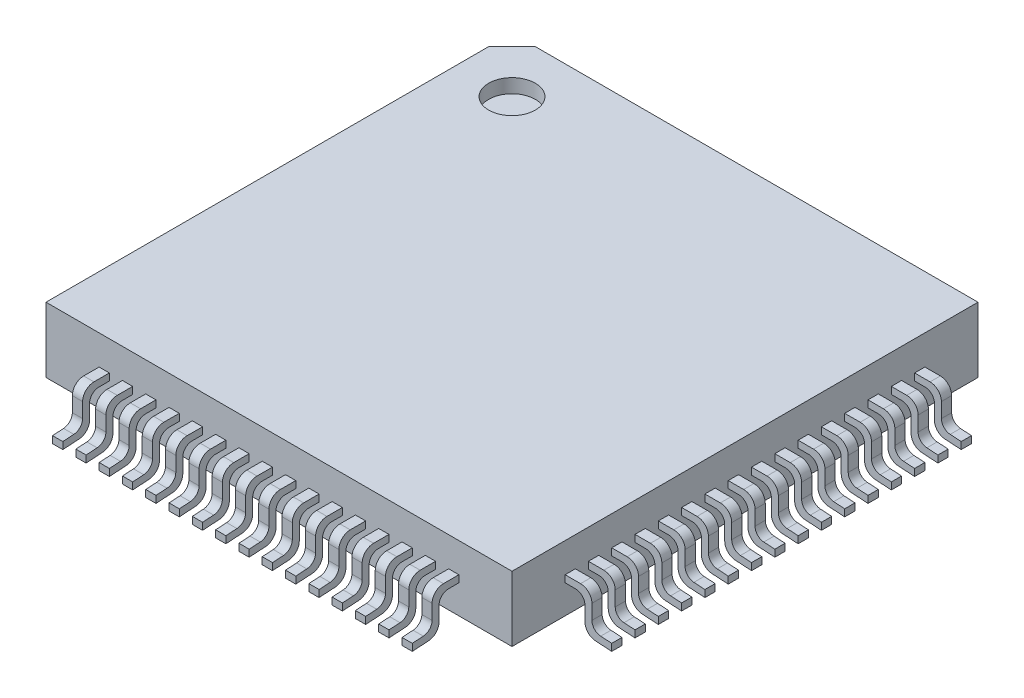
from build123d import *

# Parameters (mm, degrees)
SKETCH2_W                 = 10
SKETCH2_H                 = 10
BODY_DEPTH                = 1.4
LEAD_DEPTH                = 0.11
SD_LEADS_COUNT            = 16
SD_LEADS_PITCH            = 0.5
CIRPATTERN1_COUNT         = 4
CIRPATTERN1_COPY_1_DEPTH  = 0.11
CIRPATTERN1_COPY_2_DEPTH  = 0.11
CIRPATTERN1_COPY_3_DEPTH  = 0.11
CIRPATTERN1_COPY_4_DEPTH  = 0.11
CIRPATTERN1_COPY_5_DEPTH  = 0.11
CIRPATTERN1_COPY_6_DEPTH  = 0.11
CIRPATTERN1_COPY_7_DEPTH  = 0.11
CIRPATTERN1_COPY_8_DEPTH  = 0.11
CIRPATTERN1_COPY_9_DEPTH  = 0.11
CIRPATTERN1_COPY_10_DEPTH = 0.11
CIRPATTERN1_COPY_11_DEPTH = 0.11
CIRPATTERN1_COPY_12_DEPTH = 0.11
CIRPATTERN1_COPY_13_DEPTH = 0.11
CIRPATTERN1_COPY_14_DEPTH = 0.11
CIRPATTERN1_COPY_15_DEPTH = 0.11
CIRPATTERN1_COPY_16_DEPTH = 0.11
CIRPATTERN1_COPY_17_DEPTH = 0.11
CIRPATTERN1_COPY_18_DEPTH = 0.11
CIRPATTERN1_COPY_19_DEPTH = 0.11
CIRPATTERN1_COPY_20_DEPTH = 0.11
CIRPATTERN1_COPY_21_DEPTH = 0.11
CIRPATTERN1_COPY_22_DEPTH = 0.11
CIRPATTERN1_COPY_23_DEPTH = 0.11
CIRPATTERN1_COPY_24_DEPTH = 0.11
CIRPATTERN1_COPY_25_DEPTH = 0.11
CIRPATTERN1_COPY_26_DEPTH = 0.11
CIRPATTERN1_COPY_27_DEPTH = 0.11
CIRPATTERN1_COPY_28_DEPTH = 0.11
CIRPATTERN1_COPY_29_DEPTH = 0.11
CIRPATTERN1_COPY_30_DEPTH = 0.11
CIRPATTERN1_COPY_31_DEPTH = 0.11
CIRPATTERN1_COPY_32_DEPTH = 0.11
CIRPATTERN1_COPY_33_DEPTH = 0.11
CIRPATTERN1_COPY_34_DEPTH = 0.11
CIRPATTERN1_COPY_35_DEPTH = 0.11
CIRPATTERN1_COPY_36_DEPTH = 0.11
CIRPATTERN1_COPY_37_DEPTH = 0.11
CIRPATTERN1_COPY_38_DEPTH = 0.11
CIRPATTERN1_COPY_39_DEPTH = 0.11
CIRPATTERN1_COPY_40_DEPTH = 0.11
CIRPATTERN1_COPY_41_DEPTH = 0.11
CIRPATTERN1_COPY_42_DEPTH = 0.11
CIRPATTERN1_COPY_43_DEPTH = 0.11
CIRPATTERN1_COPY_44_DEPTH = 0.11
CIRPATTERN1_COPY_45_DEPTH = 0.11
SKETCH4_R                 = 0.5
CUT_EXTRUDE1_DEPTH        = 0.3
CHAMFER1_SIZE             = 0.5


with BuildPart() as part:
    # Sketch2 → Body (new body)
    with BuildSketch(Plane(origin=(0, 0.16, 0), x_dir=(1, 0, 0), z_dir=(0, 1, 0))):
        Rectangle(SKETCH2_W, SKETCH2_H)
    extrude(amount=BODY_DEPTH)

    # Sketch3 → Lead (add, symmetric)
    with BuildSketch(Plane.XY.offset(3.75)):
        with BuildLine():
            Line((5, 0.925), (5.331066017, 0.925))
            ThreePointArc((5.331066017, 0.925), (5.503553391, 0.853553391), (5.575, 0.681066017))
            Line((5.575, 0.681066017), (5.575, 0.36441563))
            ThreePointArc((5.575, 0.36441563), (5.629324093, 0.227380853), (5.762785301, 0.164788976))
            Line((5.762785301, 0.164788976), (6, 0.150280303))
            Line((6, 0.150280303), (6, 0))
            Line((6, 0), (5.651052254, 0.021342558))
            ThreePointArc((5.651052254, 0.021342558), (5.490394868, 0.096682424), (5.425, 0.261638181))
            Line((5.425, 0.261638181), (5.425, 0.575))
            ThreePointArc((5.425, 0.575), (5.366421356, 0.716421356), (5.225, 0.775))
            Line((5.225, 0.775), (5, 0.775))
            Line((5, 0.775), (5, 0.925))
        make_face()
    lead = extrude(amount=LEAD_DEPTH, both=True)

    # SD_Leads: Lead ×16
    with Locations(*[(0, 0, -i * SD_LEADS_PITCH) for i in range(1, SD_LEADS_COUNT)]):
        add(lead)

    # CirPattern1: Lead ×4 about axis
    cirpattern1_axis = Axis((0, 0, 0), (0, 1, 0))
    for i in range(1, CIRPATTERN1_COUNT):
        add(lead.rotate(cirpattern1_axis, i * 360 / CIRPATTERN1_COUNT))

    # CirPattern1 copy 1 sketch → CirPattern1 copy 1 (add, symmetric)
    with BuildSketch(Plane(origin=(3.25, 0, 0), x_dir=(0, 0, -1), z_dir=(1, 0, 0))):
        with BuildLine():
            Line((5, 0.925), (5.331066017, 0.925))
            ThreePointArc((5.331066017, 0.925), (5.503553391, 0.853553391), (5.575, 0.681066017))
            Line((5.575, 0.681066017), (5.575, 0.36441563))
            ThreePointArc((5.575, 0.36441563), (5.629324093, 0.227380853), (5.762785301, 0.164788976))
            Line((5.762785301, 0.164788976), (6, 0.150280303))
            Line((6, 0.150280303), (6, 0))
            Line((6, 0), (5.651052254, 0.021342558))
            ThreePointArc((5.651052254, 0.021342558), (5.490394868, 0.096682424), (5.425, 0.261638181))
            Line((5.425, 0.261638181), (5.425, 0.575))
            ThreePointArc((5.425, 0.575), (5.366421356, 0.716421356), (5.225, 0.775))
            Line((5.225, 0.775), (5, 0.775))
            Line((5, 0.775), (5, 0.925))
        make_face()
    extrude(amount=CIRPATTERN1_COPY_1_DEPTH, both=True)

    # CirPattern1 copy 2 sketch → CirPattern1 copy 2 (add, symmetric)
    with BuildSketch(Plane(origin=(0, 0, -3.25), x_dir=(-1, 0, 0), z_dir=(0, 0, -1))):
        with BuildLine():
            Line((5, 0.925), (5.331066017, 0.925))
            ThreePointArc((5.331066017, 0.925), (5.503553391, 0.853553391), (5.575, 0.681066017))
            Line((5.575, 0.681066017), (5.575, 0.36441563))
            ThreePointArc((5.575, 0.36441563), (5.629324093, 0.227380853), (5.762785301, 0.164788976))
            Line((5.762785301, 0.164788976), (6, 0.150280303))
            Line((6, 0.150280303), (6, 0))
            Line((6, 0), (5.651052254, 0.021342558))
            ThreePointArc((5.651052254, 0.021342558), (5.490394868, 0.096682424), (5.425, 0.261638181))
            Line((5.425, 0.261638181), (5.425, 0.575))
            ThreePointArc((5.425, 0.575), (5.366421356, 0.716421356), (5.225, 0.775))
            Line((5.225, 0.775), (5, 0.775))
            Line((5, 0.775), (5, 0.925))
        make_face()
    extrude(amount=CIRPATTERN1_COPY_2_DEPTH, both=True)

    # CirPattern1 copy 3 sketch → CirPattern1 copy 3 (add, symmetric)
    with BuildSketch(Plane.ZY.offset(3.25)):
        with BuildLine():
            Line((5, 0.925), (5.331066017, 0.925))
            ThreePointArc((5.331066017, 0.925), (5.503553391, 0.853553391), (5.575, 0.681066017))
            Line((5.575, 0.681066017), (5.575, 0.36441563))
            ThreePointArc((5.575, 0.36441563), (5.629324093, 0.227380853), (5.762785301, 0.164788976))
            Line((5.762785301, 0.164788976), (6, 0.150280303))
            Line((6, 0.150280303), (6, 0))
            Line((6, 0), (5.651052254, 0.021342558))
            ThreePointArc((5.651052254, 0.021342558), (5.490394868, 0.096682424), (5.425, 0.261638181))
            Line((5.425, 0.261638181), (5.425, 0.575))
            ThreePointArc((5.425, 0.575), (5.366421356, 0.716421356), (5.225, 0.775))
            Line((5.225, 0.775), (5, 0.775))
            Line((5, 0.775), (5, 0.925))
        make_face()
    extrude(amount=CIRPATTERN1_COPY_3_DEPTH, both=True)

    # CirPattern1 copy 4 sketch → CirPattern1 copy 4 (add, symmetric)
    with BuildSketch(Plane(origin=(2.75, 0, 0), x_dir=(0, 0, -1), z_dir=(1, 0, 0))):
        with BuildLine():
            Line((5, 0.925), (5.331066017, 0.925))
            ThreePointArc((5.331066017, 0.925), (5.503553391, 0.853553391), (5.575, 0.681066017))
            Line((5.575, 0.681066017), (5.575, 0.36441563))
            ThreePointArc((5.575, 0.36441563), (5.629324093, 0.227380853), (5.762785301, 0.164788976))
            Line((5.762785301, 0.164788976), (6, 0.150280303))
            Line((6, 0.150280303), (6, 0))
            Line((6, 0), (5.651052254, 0.021342558))
            ThreePointArc((5.651052254, 0.021342558), (5.490394868, 0.096682424), (5.425, 0.261638181))
            Line((5.425, 0.261638181), (5.425, 0.575))
            ThreePointArc((5.425, 0.575), (5.366421356, 0.716421356), (5.225, 0.775))
            Line((5.225, 0.775), (5, 0.775))
            Line((5, 0.775), (5, 0.925))
        make_face()
    extrude(amount=CIRPATTERN1_COPY_4_DEPTH, both=True)

    # CirPattern1 copy 5 sketch → CirPattern1 copy 5 (add, symmetric)
    with BuildSketch(Plane(origin=(0, 0, -2.75), x_dir=(-1, 0, 0), z_dir=(0, 0, -1))):
        with BuildLine():
            Line((5, 0.925), (5.331066017, 0.925))
            ThreePointArc((5.331066017, 0.925), (5.503553391, 0.853553391), (5.575, 0.681066017))
            Line((5.575, 0.681066017), (5.575, 0.36441563))
            ThreePointArc((5.575, 0.36441563), (5.629324093, 0.227380853), (5.762785301, 0.164788976))
            Line((5.762785301, 0.164788976), (6, 0.150280303))
            Line((6, 0.150280303), (6, 0))
            Line((6, 0), (5.651052254, 0.021342558))
            ThreePointArc((5.651052254, 0.021342558), (5.490394868, 0.096682424), (5.425, 0.261638181))
            Line((5.425, 0.261638181), (5.425, 0.575))
            ThreePointArc((5.425, 0.575), (5.366421356, 0.716421356), (5.225, 0.775))
            Line((5.225, 0.775), (5, 0.775))
            Line((5, 0.775), (5, 0.925))
        make_face()
    extrude(amount=CIRPATTERN1_COPY_5_DEPTH, both=True)

    # CirPattern1 copy 6 sketch → CirPattern1 copy 6 (add, symmetric)
    with BuildSketch(Plane.ZY.offset(2.75)):
        with BuildLine():
            Line((5, 0.925), (5.331066017, 0.925))
            ThreePointArc((5.331066017, 0.925), (5.503553391, 0.853553391), (5.575, 0.681066017))
            Line((5.575, 0.681066017), (5.575, 0.36441563))
            ThreePointArc((5.575, 0.36441563), (5.629324093, 0.227380853), (5.762785301, 0.164788976))
            Line((5.762785301, 0.164788976), (6, 0.150280303))
            Line((6, 0.150280303), (6, 0))
            Line((6, 0), (5.651052254, 0.021342558))
            ThreePointArc((5.651052254, 0.021342558), (5.490394868, 0.096682424), (5.425, 0.261638181))
            Line((5.425, 0.261638181), (5.425, 0.575))
            ThreePointArc((5.425, 0.575), (5.366421356, 0.716421356), (5.225, 0.775))
            Line((5.225, 0.775), (5, 0.775))
            Line((5, 0.775), (5, 0.925))
        make_face()
    extrude(amount=CIRPATTERN1_COPY_6_DEPTH, both=True)

    # CirPattern1 copy 7 sketch → CirPattern1 copy 7 (add, symmetric)
    with BuildSketch(Plane(origin=(2.25, 0, 0), x_dir=(0, 0, -1), z_dir=(1, 0, 0))):
        with BuildLine():
            Line((5, 0.925), (5.331066017, 0.925))
            ThreePointArc((5.331066017, 0.925), (5.503553391, 0.853553391), (5.575, 0.681066017))
            Line((5.575, 0.681066017), (5.575, 0.36441563))
            ThreePointArc((5.575, 0.36441563), (5.629324093, 0.227380853), (5.762785301, 0.164788976))
            Line((5.762785301, 0.164788976), (6, 0.150280303))
            Line((6, 0.150280303), (6, 0))
            Line((6, 0), (5.651052254, 0.021342558))
            ThreePointArc((5.651052254, 0.021342558), (5.490394868, 0.096682424), (5.425, 0.261638181))
            Line((5.425, 0.261638181), (5.425, 0.575))
            ThreePointArc((5.425, 0.575), (5.366421356, 0.716421356), (5.225, 0.775))
            Line((5.225, 0.775), (5, 0.775))
            Line((5, 0.775), (5, 0.925))
        make_face()
    extrude(amount=CIRPATTERN1_COPY_7_DEPTH, both=True)

    # CirPattern1 copy 8 sketch → CirPattern1 copy 8 (add, symmetric)
    with BuildSketch(Plane(origin=(0, 0, -2.25), x_dir=(-1, 0, 0), z_dir=(0, 0, -1))):
        with BuildLine():
            Line((5, 0.925), (5.331066017, 0.925))
            ThreePointArc((5.331066017, 0.925), (5.503553391, 0.853553391), (5.575, 0.681066017))
            Line((5.575, 0.681066017), (5.575, 0.36441563))
            ThreePointArc((5.575, 0.36441563), (5.629324093, 0.227380853), (5.762785301, 0.164788976))
            Line((5.762785301, 0.164788976), (6, 0.150280303))
            Line((6, 0.150280303), (6, 0))
            Line((6, 0), (5.651052254, 0.021342558))
            ThreePointArc((5.651052254, 0.021342558), (5.490394868, 0.096682424), (5.425, 0.261638181))
            Line((5.425, 0.261638181), (5.425, 0.575))
            ThreePointArc((5.425, 0.575), (5.366421356, 0.716421356), (5.225, 0.775))
            Line((5.225, 0.775), (5, 0.775))
            Line((5, 0.775), (5, 0.925))
        make_face()
    extrude(amount=CIRPATTERN1_COPY_8_DEPTH, both=True)

    # CirPattern1 copy 9 sketch → CirPattern1 copy 9 (add, symmetric)
    with BuildSketch(Plane.ZY.offset(2.25)):
        with BuildLine():
            Line((5, 0.925), (5.331066017, 0.925))
            ThreePointArc((5.331066017, 0.925), (5.503553391, 0.853553391), (5.575, 0.681066017))
            Line((5.575, 0.681066017), (5.575, 0.36441563))
            ThreePointArc((5.575, 0.36441563), (5.629324093, 0.227380853), (5.762785301, 0.164788976))
            Line((5.762785301, 0.164788976), (6, 0.150280303))
            Line((6, 0.150280303), (6, 0))
            Line((6, 0), (5.651052254, 0.021342558))
            ThreePointArc((5.651052254, 0.021342558), (5.490394868, 0.096682424), (5.425, 0.261638181))
            Line((5.425, 0.261638181), (5.425, 0.575))
            ThreePointArc((5.425, 0.575), (5.366421356, 0.716421356), (5.225, 0.775))
            Line((5.225, 0.775), (5, 0.775))
            Line((5, 0.775), (5, 0.925))
        make_face()
    extrude(amount=CIRPATTERN1_COPY_9_DEPTH, both=True)

    # CirPattern1 copy 10 sketch → CirPattern1 copy 10 (add, symmetric)
    with BuildSketch(Plane(origin=(1.75, 0, 0), x_dir=(0, 0, -1), z_dir=(1, 0, 0))):
        with BuildLine():
            Line((5, 0.925), (5.331066017, 0.925))
            ThreePointArc((5.331066017, 0.925), (5.503553391, 0.853553391), (5.575, 0.681066017))
            Line((5.575, 0.681066017), (5.575, 0.36441563))
            ThreePointArc((5.575, 0.36441563), (5.629324093, 0.227380853), (5.762785301, 0.164788976))
            Line((5.762785301, 0.164788976), (6, 0.150280303))
            Line((6, 0.150280303), (6, 0))
            Line((6, 0), (5.651052254, 0.021342558))
            ThreePointArc((5.651052254, 0.021342558), (5.490394868, 0.096682424), (5.425, 0.261638181))
            Line((5.425, 0.261638181), (5.425, 0.575))
            ThreePointArc((5.425, 0.575), (5.366421356, 0.716421356), (5.225, 0.775))
            Line((5.225, 0.775), (5, 0.775))
            Line((5, 0.775), (5, 0.925))
        make_face()
    extrude(amount=CIRPATTERN1_COPY_10_DEPTH, both=True)

    # CirPattern1 copy 11 sketch → CirPattern1 copy 11 (add, symmetric)
    with BuildSketch(Plane(origin=(0, 0, -1.75), x_dir=(-1, 0, 0), z_dir=(0, 0, -1))):
        with BuildLine():
            Line((5, 0.925), (5.331066017, 0.925))
            ThreePointArc((5.331066017, 0.925), (5.503553391, 0.853553391), (5.575, 0.681066017))
            Line((5.575, 0.681066017), (5.575, 0.36441563))
            ThreePointArc((5.575, 0.36441563), (5.629324093, 0.227380853), (5.762785301, 0.164788976))
            Line((5.762785301, 0.164788976), (6, 0.150280303))
            Line((6, 0.150280303), (6, 0))
            Line((6, 0), (5.651052254, 0.021342558))
            ThreePointArc((5.651052254, 0.021342558), (5.490394868, 0.096682424), (5.425, 0.261638181))
            Line((5.425, 0.261638181), (5.425, 0.575))
            ThreePointArc((5.425, 0.575), (5.366421356, 0.716421356), (5.225, 0.775))
            Line((5.225, 0.775), (5, 0.775))
            Line((5, 0.775), (5, 0.925))
        make_face()
    extrude(amount=CIRPATTERN1_COPY_11_DEPTH, both=True)

    # CirPattern1 copy 12 sketch → CirPattern1 copy 12 (add, symmetric)
    with BuildSketch(Plane.ZY.offset(1.75)):
        with BuildLine():
            Line((5, 0.925), (5.331066017, 0.925))
            ThreePointArc((5.331066017, 0.925), (5.503553391, 0.853553391), (5.575, 0.681066017))
            Line((5.575, 0.681066017), (5.575, 0.36441563))
            ThreePointArc((5.575, 0.36441563), (5.629324093, 0.227380853), (5.762785301, 0.164788976))
            Line((5.762785301, 0.164788976), (6, 0.150280303))
            Line((6, 0.150280303), (6, 0))
            Line((6, 0), (5.651052254, 0.021342558))
            ThreePointArc((5.651052254, 0.021342558), (5.490394868, 0.096682424), (5.425, 0.261638181))
            Line((5.425, 0.261638181), (5.425, 0.575))
            ThreePointArc((5.425, 0.575), (5.366421356, 0.716421356), (5.225, 0.775))
            Line((5.225, 0.775), (5, 0.775))
            Line((5, 0.775), (5, 0.925))
        make_face()
    extrude(amount=CIRPATTERN1_COPY_12_DEPTH, both=True)

    # CirPattern1 copy 13 sketch → CirPattern1 copy 13 (add, symmetric)
    with BuildSketch(Plane(origin=(1.25, 0, 0), x_dir=(0, 0, -1), z_dir=(1, 0, 0))):
        with BuildLine():
            Line((5, 0.925), (5.331066017, 0.925))
            ThreePointArc((5.331066017, 0.925), (5.503553391, 0.853553391), (5.575, 0.681066017))
            Line((5.575, 0.681066017), (5.575, 0.36441563))
            ThreePointArc((5.575, 0.36441563), (5.629324093, 0.227380853), (5.762785301, 0.164788976))
            Line((5.762785301, 0.164788976), (6, 0.150280303))
            Line((6, 0.150280303), (6, 0))
            Line((6, 0), (5.651052254, 0.021342558))
            ThreePointArc((5.651052254, 0.021342558), (5.490394868, 0.096682424), (5.425, 0.261638181))
            Line((5.425, 0.261638181), (5.425, 0.575))
            ThreePointArc((5.425, 0.575), (5.366421356, 0.716421356), (5.225, 0.775))
            Line((5.225, 0.775), (5, 0.775))
            Line((5, 0.775), (5, 0.925))
        make_face()
    extrude(amount=CIRPATTERN1_COPY_13_DEPTH, both=True)

    # CirPattern1 copy 14 sketch → CirPattern1 copy 14 (add, symmetric)
    with BuildSketch(Plane(origin=(0, 0, -1.25), x_dir=(-1, 0, 0), z_dir=(0, 0, -1))):
        with BuildLine():
            Line((5, 0.925), (5.331066017, 0.925))
            ThreePointArc((5.331066017, 0.925), (5.503553391, 0.853553391), (5.575, 0.681066017))
            Line((5.575, 0.681066017), (5.575, 0.36441563))
            ThreePointArc((5.575, 0.36441563), (5.629324093, 0.227380853), (5.762785301, 0.164788976))
            Line((5.762785301, 0.164788976), (6, 0.150280303))
            Line((6, 0.150280303), (6, 0))
            Line((6, 0), (5.651052254, 0.021342558))
            ThreePointArc((5.651052254, 0.021342558), (5.490394868, 0.096682424), (5.425, 0.261638181))
            Line((5.425, 0.261638181), (5.425, 0.575))
            ThreePointArc((5.425, 0.575), (5.366421356, 0.716421356), (5.225, 0.775))
            Line((5.225, 0.775), (5, 0.775))
            Line((5, 0.775), (5, 0.925))
        make_face()
    extrude(amount=CIRPATTERN1_COPY_14_DEPTH, both=True)

    # CirPattern1 copy 15 sketch → CirPattern1 copy 15 (add, symmetric)
    with BuildSketch(Plane.ZY.offset(1.25)):
        with BuildLine():
            Line((5, 0.925), (5.331066017, 0.925))
            ThreePointArc((5.331066017, 0.925), (5.503553391, 0.853553391), (5.575, 0.681066017))
            Line((5.575, 0.681066017), (5.575, 0.36441563))
            ThreePointArc((5.575, 0.36441563), (5.629324093, 0.227380853), (5.762785301, 0.164788976))
            Line((5.762785301, 0.164788976), (6, 0.150280303))
            Line((6, 0.150280303), (6, 0))
            Line((6, 0), (5.651052254, 0.021342558))
            ThreePointArc((5.651052254, 0.021342558), (5.490394868, 0.096682424), (5.425, 0.261638181))
            Line((5.425, 0.261638181), (5.425, 0.575))
            ThreePointArc((5.425, 0.575), (5.366421356, 0.716421356), (5.225, 0.775))
            Line((5.225, 0.775), (5, 0.775))
            Line((5, 0.775), (5, 0.925))
        make_face()
    extrude(amount=CIRPATTERN1_COPY_15_DEPTH, both=True)

    # CirPattern1 copy 16 sketch → CirPattern1 copy 16 (add, symmetric)
    with BuildSketch(Plane(origin=(0.75, 0, 0), x_dir=(0, 0, -1), z_dir=(1, 0, 0))):
        with BuildLine():
            Line((5, 0.925), (5.331066017, 0.925))
            ThreePointArc((5.331066017, 0.925), (5.503553391, 0.853553391), (5.575, 0.681066017))
            Line((5.575, 0.681066017), (5.575, 0.36441563))
            ThreePointArc((5.575, 0.36441563), (5.629324093, 0.227380853), (5.762785301, 0.164788976))
            Line((5.762785301, 0.164788976), (6, 0.150280303))
            Line((6, 0.150280303), (6, 0))
            Line((6, 0), (5.651052254, 0.021342558))
            ThreePointArc((5.651052254, 0.021342558), (5.490394868, 0.096682424), (5.425, 0.261638181))
            Line((5.425, 0.261638181), (5.425, 0.575))
            ThreePointArc((5.425, 0.575), (5.366421356, 0.716421356), (5.225, 0.775))
            Line((5.225, 0.775), (5, 0.775))
            Line((5, 0.775), (5, 0.925))
        make_face()
    extrude(amount=CIRPATTERN1_COPY_16_DEPTH, both=True)

    # CirPattern1 copy 17 sketch → CirPattern1 copy 17 (add, symmetric)
    with BuildSketch(Plane(origin=(0, 0, -0.75), x_dir=(-1, 0, 0), z_dir=(0, 0, -1))):
        with BuildLine():
            Line((5, 0.925), (5.331066017, 0.925))
            ThreePointArc((5.331066017, 0.925), (5.503553391, 0.853553391), (5.575, 0.681066017))
            Line((5.575, 0.681066017), (5.575, 0.36441563))
            ThreePointArc((5.575, 0.36441563), (5.629324093, 0.227380853), (5.762785301, 0.164788976))
            Line((5.762785301, 0.164788976), (6, 0.150280303))
            Line((6, 0.150280303), (6, 0))
            Line((6, 0), (5.651052254, 0.021342558))
            ThreePointArc((5.651052254, 0.021342558), (5.490394868, 0.096682424), (5.425, 0.261638181))
            Line((5.425, 0.261638181), (5.425, 0.575))
            ThreePointArc((5.425, 0.575), (5.366421356, 0.716421356), (5.225, 0.775))
            Line((5.225, 0.775), (5, 0.775))
            Line((5, 0.775), (5, 0.925))
        make_face()
    extrude(amount=CIRPATTERN1_COPY_17_DEPTH, both=True)

    # CirPattern1 copy 18 sketch → CirPattern1 copy 18 (add, symmetric)
    with BuildSketch(Plane.ZY.offset(0.75)):
        with BuildLine():
            Line((5, 0.925), (5.331066017, 0.925))
            ThreePointArc((5.331066017, 0.925), (5.503553391, 0.853553391), (5.575, 0.681066017))
            Line((5.575, 0.681066017), (5.575, 0.36441563))
            ThreePointArc((5.575, 0.36441563), (5.629324093, 0.227380853), (5.762785301, 0.164788976))
            Line((5.762785301, 0.164788976), (6, 0.150280303))
            Line((6, 0.150280303), (6, 0))
            Line((6, 0), (5.651052254, 0.021342558))
            ThreePointArc((5.651052254, 0.021342558), (5.490394868, 0.096682424), (5.425, 0.261638181))
            Line((5.425, 0.261638181), (5.425, 0.575))
            ThreePointArc((5.425, 0.575), (5.366421356, 0.716421356), (5.225, 0.775))
            Line((5.225, 0.775), (5, 0.775))
            Line((5, 0.775), (5, 0.925))
        make_face()
    extrude(amount=CIRPATTERN1_COPY_18_DEPTH, both=True)

    # CirPattern1 copy 19 sketch → CirPattern1 copy 19 (add, symmetric)
    with BuildSketch(Plane(origin=(0.25, 0, 0), x_dir=(0, 0, -1), z_dir=(1, 0, 0))):
        with BuildLine():
            Line((5, 0.925), (5.331066017, 0.925))
            ThreePointArc((5.331066017, 0.925), (5.503553391, 0.853553391), (5.575, 0.681066017))
            Line((5.575, 0.681066017), (5.575, 0.36441563))
            ThreePointArc((5.575, 0.36441563), (5.629324093, 0.227380853), (5.762785301, 0.164788976))
            Line((5.762785301, 0.164788976), (6, 0.150280303))
            Line((6, 0.150280303), (6, 0))
            Line((6, 0), (5.651052254, 0.021342558))
            ThreePointArc((5.651052254, 0.021342558), (5.490394868, 0.096682424), (5.425, 0.261638181))
            Line((5.425, 0.261638181), (5.425, 0.575))
            ThreePointArc((5.425, 0.575), (5.366421356, 0.716421356), (5.225, 0.775))
            Line((5.225, 0.775), (5, 0.775))
            Line((5, 0.775), (5, 0.925))
        make_face()
    extrude(amount=CIRPATTERN1_COPY_19_DEPTH, both=True)

    # CirPattern1 copy 20 sketch → CirPattern1 copy 20 (add, symmetric)
    with BuildSketch(Plane(origin=(0, 0, -0.25), x_dir=(-1, 0, 0), z_dir=(0, 0, -1))):
        with BuildLine():
            Line((5, 0.925), (5.331066017, 0.925))
            ThreePointArc((5.331066017, 0.925), (5.503553391, 0.853553391), (5.575, 0.681066017))
            Line((5.575, 0.681066017), (5.575, 0.36441563))
            ThreePointArc((5.575, 0.36441563), (5.629324093, 0.227380853), (5.762785301, 0.164788976))
            Line((5.762785301, 0.164788976), (6, 0.150280303))
            Line((6, 0.150280303), (6, 0))
            Line((6, 0), (5.651052254, 0.021342558))
            ThreePointArc((5.651052254, 0.021342558), (5.490394868, 0.096682424), (5.425, 0.261638181))
            Line((5.425, 0.261638181), (5.425, 0.575))
            ThreePointArc((5.425, 0.575), (5.366421356, 0.716421356), (5.225, 0.775))
            Line((5.225, 0.775), (5, 0.775))
            Line((5, 0.775), (5, 0.925))
        make_face()
    extrude(amount=CIRPATTERN1_COPY_20_DEPTH, both=True)

    # CirPattern1 copy 21 sketch → CirPattern1 copy 21 (add, symmetric)
    with BuildSketch(Plane.ZY.offset(0.25)):
        with BuildLine():
            Line((5, 0.925), (5.331066017, 0.925))
            ThreePointArc((5.331066017, 0.925), (5.503553391, 0.853553391), (5.575, 0.681066017))
            Line((5.575, 0.681066017), (5.575, 0.36441563))
            ThreePointArc((5.575, 0.36441563), (5.629324093, 0.227380853), (5.762785301, 0.164788976))
            Line((5.762785301, 0.164788976), (6, 0.150280303))
            Line((6, 0.150280303), (6, 0))
            Line((6, 0), (5.651052254, 0.021342558))
            ThreePointArc((5.651052254, 0.021342558), (5.490394868, 0.096682424), (5.425, 0.261638181))
            Line((5.425, 0.261638181), (5.425, 0.575))
            ThreePointArc((5.425, 0.575), (5.366421356, 0.716421356), (5.225, 0.775))
            Line((5.225, 0.775), (5, 0.775))
            Line((5, 0.775), (5, 0.925))
        make_face()
    extrude(amount=CIRPATTERN1_COPY_21_DEPTH, both=True)

    # CirPattern1 copy 22 sketch → CirPattern1 copy 22 (add, symmetric)
    with BuildSketch(Plane(origin=(-0.25, 0, 0), x_dir=(0, 0, -1), z_dir=(1, 0, 0))):
        with BuildLine():
            Line((5, 0.925), (5.331066017, 0.925))
            ThreePointArc((5.331066017, 0.925), (5.503553391, 0.853553391), (5.575, 0.681066017))
            Line((5.575, 0.681066017), (5.575, 0.36441563))
            ThreePointArc((5.575, 0.36441563), (5.629324093, 0.227380853), (5.762785301, 0.164788976))
            Line((5.762785301, 0.164788976), (6, 0.150280303))
            Line((6, 0.150280303), (6, 0))
            Line((6, 0), (5.651052254, 0.021342558))
            ThreePointArc((5.651052254, 0.021342558), (5.490394868, 0.096682424), (5.425, 0.261638181))
            Line((5.425, 0.261638181), (5.425, 0.575))
            ThreePointArc((5.425, 0.575), (5.366421356, 0.716421356), (5.225, 0.775))
            Line((5.225, 0.775), (5, 0.775))
            Line((5, 0.775), (5, 0.925))
        make_face()
    extrude(amount=CIRPATTERN1_COPY_22_DEPTH, both=True)

    # CirPattern1 copy 23 sketch → CirPattern1 copy 23 (add, symmetric)
    with BuildSketch(Plane(origin=(0, 0, 0.25), x_dir=(-1, 0, 0), z_dir=(0, 0, -1))):
        with BuildLine():
            Line((5, 0.925), (5.331066017, 0.925))
            ThreePointArc((5.331066017, 0.925), (5.503553391, 0.853553391), (5.575, 0.681066017))
            Line((5.575, 0.681066017), (5.575, 0.36441563))
            ThreePointArc((5.575, 0.36441563), (5.629324093, 0.227380853), (5.762785301, 0.164788976))
            Line((5.762785301, 0.164788976), (6, 0.150280303))
            Line((6, 0.150280303), (6, 0))
            Line((6, 0), (5.651052254, 0.021342558))
            ThreePointArc((5.651052254, 0.021342558), (5.490394868, 0.096682424), (5.425, 0.261638181))
            Line((5.425, 0.261638181), (5.425, 0.575))
            ThreePointArc((5.425, 0.575), (5.366421356, 0.716421356), (5.225, 0.775))
            Line((5.225, 0.775), (5, 0.775))
            Line((5, 0.775), (5, 0.925))
        make_face()
    extrude(amount=CIRPATTERN1_COPY_23_DEPTH, both=True)

    # CirPattern1 copy 24 sketch → CirPattern1 copy 24 (add, symmetric)
    with BuildSketch(Plane.ZY.offset(-0.25)):
        with BuildLine():
            Line((5, 0.925), (5.331066017, 0.925))
            ThreePointArc((5.331066017, 0.925), (5.503553391, 0.853553391), (5.575, 0.681066017))
            Line((5.575, 0.681066017), (5.575, 0.36441563))
            ThreePointArc((5.575, 0.36441563), (5.629324093, 0.227380853), (5.762785301, 0.164788976))
            Line((5.762785301, 0.164788976), (6, 0.150280303))
            Line((6, 0.150280303), (6, 0))
            Line((6, 0), (5.651052254, 0.021342558))
            ThreePointArc((5.651052254, 0.021342558), (5.490394868, 0.096682424), (5.425, 0.261638181))
            Line((5.425, 0.261638181), (5.425, 0.575))
            ThreePointArc((5.425, 0.575), (5.366421356, 0.716421356), (5.225, 0.775))
            Line((5.225, 0.775), (5, 0.775))
            Line((5, 0.775), (5, 0.925))
        make_face()
    extrude(amount=CIRPATTERN1_COPY_24_DEPTH, both=True)

    # CirPattern1 copy 25 sketch → CirPattern1 copy 25 (add, symmetric)
    with BuildSketch(Plane(origin=(-0.75, 0, 0), x_dir=(0, 0, -1), z_dir=(1, 0, 0))):
        with BuildLine():
            Line((5, 0.925), (5.331066017, 0.925))
            ThreePointArc((5.331066017, 0.925), (5.503553391, 0.853553391), (5.575, 0.681066017))
            Line((5.575, 0.681066017), (5.575, 0.36441563))
            ThreePointArc((5.575, 0.36441563), (5.629324093, 0.227380853), (5.762785301, 0.164788976))
            Line((5.762785301, 0.164788976), (6, 0.150280303))
            Line((6, 0.150280303), (6, 0))
            Line((6, 0), (5.651052254, 0.021342558))
            ThreePointArc((5.651052254, 0.021342558), (5.490394868, 0.096682424), (5.425, 0.261638181))
            Line((5.425, 0.261638181), (5.425, 0.575))
            ThreePointArc((5.425, 0.575), (5.366421356, 0.716421356), (5.225, 0.775))
            Line((5.225, 0.775), (5, 0.775))
            Line((5, 0.775), (5, 0.925))
        make_face()
    extrude(amount=CIRPATTERN1_COPY_25_DEPTH, both=True)

    # CirPattern1 copy 26 sketch → CirPattern1 copy 26 (add, symmetric)
    with BuildSketch(Plane(origin=(0, 0, 0.75), x_dir=(-1, 0, 0), z_dir=(0, 0, -1))):
        with BuildLine():
            Line((5, 0.925), (5.331066017, 0.925))
            ThreePointArc((5.331066017, 0.925), (5.503553391, 0.853553391), (5.575, 0.681066017))
            Line((5.575, 0.681066017), (5.575, 0.36441563))
            ThreePointArc((5.575, 0.36441563), (5.629324093, 0.227380853), (5.762785301, 0.164788976))
            Line((5.762785301, 0.164788976), (6, 0.150280303))
            Line((6, 0.150280303), (6, 0))
            Line((6, 0), (5.651052254, 0.021342558))
            ThreePointArc((5.651052254, 0.021342558), (5.490394868, 0.096682424), (5.425, 0.261638181))
            Line((5.425, 0.261638181), (5.425, 0.575))
            ThreePointArc((5.425, 0.575), (5.366421356, 0.716421356), (5.225, 0.775))
            Line((5.225, 0.775), (5, 0.775))
            Line((5, 0.775), (5, 0.925))
        make_face()
    extrude(amount=CIRPATTERN1_COPY_26_DEPTH, both=True)

    # CirPattern1 copy 27 sketch → CirPattern1 copy 27 (add, symmetric)
    with BuildSketch(Plane.ZY.offset(-0.75)):
        with BuildLine():
            Line((5, 0.925), (5.331066017, 0.925))
            ThreePointArc((5.331066017, 0.925), (5.503553391, 0.853553391), (5.575, 0.681066017))
            Line((5.575, 0.681066017), (5.575, 0.36441563))
            ThreePointArc((5.575, 0.36441563), (5.629324093, 0.227380853), (5.762785301, 0.164788976))
            Line((5.762785301, 0.164788976), (6, 0.150280303))
            Line((6, 0.150280303), (6, 0))
            Line((6, 0), (5.651052254, 0.021342558))
            ThreePointArc((5.651052254, 0.021342558), (5.490394868, 0.096682424), (5.425, 0.261638181))
            Line((5.425, 0.261638181), (5.425, 0.575))
            ThreePointArc((5.425, 0.575), (5.366421356, 0.716421356), (5.225, 0.775))
            Line((5.225, 0.775), (5, 0.775))
            Line((5, 0.775), (5, 0.925))
        make_face()
    extrude(amount=CIRPATTERN1_COPY_27_DEPTH, both=True)

    # CirPattern1 copy 28 sketch → CirPattern1 copy 28 (add, symmetric)
    with BuildSketch(Plane(origin=(-1.25, 0, 0), x_dir=(0, 0, -1), z_dir=(1, 0, 0))):
        with BuildLine():
            Line((5, 0.925), (5.331066017, 0.925))
            ThreePointArc((5.331066017, 0.925), (5.503553391, 0.853553391), (5.575, 0.681066017))
            Line((5.575, 0.681066017), (5.575, 0.36441563))
            ThreePointArc((5.575, 0.36441563), (5.629324093, 0.227380853), (5.762785301, 0.164788976))
            Line((5.762785301, 0.164788976), (6, 0.150280303))
            Line((6, 0.150280303), (6, 0))
            Line((6, 0), (5.651052254, 0.021342558))
            ThreePointArc((5.651052254, 0.021342558), (5.490394868, 0.096682424), (5.425, 0.261638181))
            Line((5.425, 0.261638181), (5.425, 0.575))
            ThreePointArc((5.425, 0.575), (5.366421356, 0.716421356), (5.225, 0.775))
            Line((5.225, 0.775), (5, 0.775))
            Line((5, 0.775), (5, 0.925))
        make_face()
    extrude(amount=CIRPATTERN1_COPY_28_DEPTH, both=True)

    # CirPattern1 copy 29 sketch → CirPattern1 copy 29 (add, symmetric)
    with BuildSketch(Plane(origin=(0, 0, 1.25), x_dir=(-1, 0, 0), z_dir=(0, 0, -1))):
        with BuildLine():
            Line((5, 0.925), (5.331066017, 0.925))
            ThreePointArc((5.331066017, 0.925), (5.503553391, 0.853553391), (5.575, 0.681066017))
            Line((5.575, 0.681066017), (5.575, 0.36441563))
            ThreePointArc((5.575, 0.36441563), (5.629324093, 0.227380853), (5.762785301, 0.164788976))
            Line((5.762785301, 0.164788976), (6, 0.150280303))
            Line((6, 0.150280303), (6, 0))
            Line((6, 0), (5.651052254, 0.021342558))
            ThreePointArc((5.651052254, 0.021342558), (5.490394868, 0.096682424), (5.425, 0.261638181))
            Line((5.425, 0.261638181), (5.425, 0.575))
            ThreePointArc((5.425, 0.575), (5.366421356, 0.716421356), (5.225, 0.775))
            Line((5.225, 0.775), (5, 0.775))
            Line((5, 0.775), (5, 0.925))
        make_face()
    extrude(amount=CIRPATTERN1_COPY_29_DEPTH, both=True)

    # CirPattern1 copy 30 sketch → CirPattern1 copy 30 (add, symmetric)
    with BuildSketch(Plane.ZY.offset(-1.25)):
        with BuildLine():
            Line((5, 0.925), (5.331066017, 0.925))
            ThreePointArc((5.331066017, 0.925), (5.503553391, 0.853553391), (5.575, 0.681066017))
            Line((5.575, 0.681066017), (5.575, 0.36441563))
            ThreePointArc((5.575, 0.36441563), (5.629324093, 0.227380853), (5.762785301, 0.164788976))
            Line((5.762785301, 0.164788976), (6, 0.150280303))
            Line((6, 0.150280303), (6, 0))
            Line((6, 0), (5.651052254, 0.021342558))
            ThreePointArc((5.651052254, 0.021342558), (5.490394868, 0.096682424), (5.425, 0.261638181))
            Line((5.425, 0.261638181), (5.425, 0.575))
            ThreePointArc((5.425, 0.575), (5.366421356, 0.716421356), (5.225, 0.775))
            Line((5.225, 0.775), (5, 0.775))
            Line((5, 0.775), (5, 0.925))
        make_face()
    extrude(amount=CIRPATTERN1_COPY_30_DEPTH, both=True)

    # CirPattern1 copy 31 sketch → CirPattern1 copy 31 (add, symmetric)
    with BuildSketch(Plane(origin=(-1.75, 0, 0), x_dir=(0, 0, -1), z_dir=(1, 0, 0))):
        with BuildLine():
            Line((5, 0.925), (5.331066017, 0.925))
            ThreePointArc((5.331066017, 0.925), (5.503553391, 0.853553391), (5.575, 0.681066017))
            Line((5.575, 0.681066017), (5.575, 0.36441563))
            ThreePointArc((5.575, 0.36441563), (5.629324093, 0.227380853), (5.762785301, 0.164788976))
            Line((5.762785301, 0.164788976), (6, 0.150280303))
            Line((6, 0.150280303), (6, 0))
            Line((6, 0), (5.651052254, 0.021342558))
            ThreePointArc((5.651052254, 0.021342558), (5.490394868, 0.096682424), (5.425, 0.261638181))
            Line((5.425, 0.261638181), (5.425, 0.575))
            ThreePointArc((5.425, 0.575), (5.366421356, 0.716421356), (5.225, 0.775))
            Line((5.225, 0.775), (5, 0.775))
            Line((5, 0.775), (5, 0.925))
        make_face()
    extrude(amount=CIRPATTERN1_COPY_31_DEPTH, both=True)

    # CirPattern1 copy 32 sketch → CirPattern1 copy 32 (add, symmetric)
    with BuildSketch(Plane(origin=(0, 0, 1.75), x_dir=(-1, 0, 0), z_dir=(0, 0, -1))):
        with BuildLine():
            Line((5, 0.925), (5.331066017, 0.925))
            ThreePointArc((5.331066017, 0.925), (5.503553391, 0.853553391), (5.575, 0.681066017))
            Line((5.575, 0.681066017), (5.575, 0.36441563))
            ThreePointArc((5.575, 0.36441563), (5.629324093, 0.227380853), (5.762785301, 0.164788976))
            Line((5.762785301, 0.164788976), (6, 0.150280303))
            Line((6, 0.150280303), (6, 0))
            Line((6, 0), (5.651052254, 0.021342558))
            ThreePointArc((5.651052254, 0.021342558), (5.490394868, 0.096682424), (5.425, 0.261638181))
            Line((5.425, 0.261638181), (5.425, 0.575))
            ThreePointArc((5.425, 0.575), (5.366421356, 0.716421356), (5.225, 0.775))
            Line((5.225, 0.775), (5, 0.775))
            Line((5, 0.775), (5, 0.925))
        make_face()
    extrude(amount=CIRPATTERN1_COPY_32_DEPTH, both=True)

    # CirPattern1 copy 33 sketch → CirPattern1 copy 33 (add, symmetric)
    with BuildSketch(Plane.ZY.offset(-1.75)):
        with BuildLine():
            Line((5, 0.925), (5.331066017, 0.925))
            ThreePointArc((5.331066017, 0.925), (5.503553391, 0.853553391), (5.575, 0.681066017))
            Line((5.575, 0.681066017), (5.575, 0.36441563))
            ThreePointArc((5.575, 0.36441563), (5.629324093, 0.227380853), (5.762785301, 0.164788976))
            Line((5.762785301, 0.164788976), (6, 0.150280303))
            Line((6, 0.150280303), (6, 0))
            Line((6, 0), (5.651052254, 0.021342558))
            ThreePointArc((5.651052254, 0.021342558), (5.490394868, 0.096682424), (5.425, 0.261638181))
            Line((5.425, 0.261638181), (5.425, 0.575))
            ThreePointArc((5.425, 0.575), (5.366421356, 0.716421356), (5.225, 0.775))
            Line((5.225, 0.775), (5, 0.775))
            Line((5, 0.775), (5, 0.925))
        make_face()
    extrude(amount=CIRPATTERN1_COPY_33_DEPTH, both=True)

    # CirPattern1 copy 34 sketch → CirPattern1 copy 34 (add, symmetric)
    with BuildSketch(Plane(origin=(-2.25, 0, 0), x_dir=(0, 0, -1), z_dir=(1, 0, 0))):
        with BuildLine():
            Line((5, 0.925), (5.331066017, 0.925))
            ThreePointArc((5.331066017, 0.925), (5.503553391, 0.853553391), (5.575, 0.681066017))
            Line((5.575, 0.681066017), (5.575, 0.36441563))
            ThreePointArc((5.575, 0.36441563), (5.629324093, 0.227380853), (5.762785301, 0.164788976))
            Line((5.762785301, 0.164788976), (6, 0.150280303))
            Line((6, 0.150280303), (6, 0))
            Line((6, 0), (5.651052254, 0.021342558))
            ThreePointArc((5.651052254, 0.021342558), (5.490394868, 0.096682424), (5.425, 0.261638181))
            Line((5.425, 0.261638181), (5.425, 0.575))
            ThreePointArc((5.425, 0.575), (5.366421356, 0.716421356), (5.225, 0.775))
            Line((5.225, 0.775), (5, 0.775))
            Line((5, 0.775), (5, 0.925))
        make_face()
    extrude(amount=CIRPATTERN1_COPY_34_DEPTH, both=True)

    # CirPattern1 copy 35 sketch → CirPattern1 copy 35 (add, symmetric)
    with BuildSketch(Plane(origin=(0, 0, 2.25), x_dir=(-1, 0, 0), z_dir=(0, 0, -1))):
        with BuildLine():
            Line((5, 0.925), (5.331066017, 0.925))
            ThreePointArc((5.331066017, 0.925), (5.503553391, 0.853553391), (5.575, 0.681066017))
            Line((5.575, 0.681066017), (5.575, 0.36441563))
            ThreePointArc((5.575, 0.36441563), (5.629324093, 0.227380853), (5.762785301, 0.164788976))
            Line((5.762785301, 0.164788976), (6, 0.150280303))
            Line((6, 0.150280303), (6, 0))
            Line((6, 0), (5.651052254, 0.021342558))
            ThreePointArc((5.651052254, 0.021342558), (5.490394868, 0.096682424), (5.425, 0.261638181))
            Line((5.425, 0.261638181), (5.425, 0.575))
            ThreePointArc((5.425, 0.575), (5.366421356, 0.716421356), (5.225, 0.775))
            Line((5.225, 0.775), (5, 0.775))
            Line((5, 0.775), (5, 0.925))
        make_face()
    extrude(amount=CIRPATTERN1_COPY_35_DEPTH, both=True)

    # CirPattern1 copy 36 sketch → CirPattern1 copy 36 (add, symmetric)
    with BuildSketch(Plane.ZY.offset(-2.25)):
        with BuildLine():
            Line((5, 0.925), (5.331066017, 0.925))
            ThreePointArc((5.331066017, 0.925), (5.503553391, 0.853553391), (5.575, 0.681066017))
            Line((5.575, 0.681066017), (5.575, 0.36441563))
            ThreePointArc((5.575, 0.36441563), (5.629324093, 0.227380853), (5.762785301, 0.164788976))
            Line((5.762785301, 0.164788976), (6, 0.150280303))
            Line((6, 0.150280303), (6, 0))
            Line((6, 0), (5.651052254, 0.021342558))
            ThreePointArc((5.651052254, 0.021342558), (5.490394868, 0.096682424), (5.425, 0.261638181))
            Line((5.425, 0.261638181), (5.425, 0.575))
            ThreePointArc((5.425, 0.575), (5.366421356, 0.716421356), (5.225, 0.775))
            Line((5.225, 0.775), (5, 0.775))
            Line((5, 0.775), (5, 0.925))
        make_face()
    extrude(amount=CIRPATTERN1_COPY_36_DEPTH, both=True)

    # CirPattern1 copy 37 sketch → CirPattern1 copy 37 (add, symmetric)
    with BuildSketch(Plane(origin=(-2.75, 0, 0), x_dir=(0, 0, -1), z_dir=(1, 0, 0))):
        with BuildLine():
            Line((5, 0.925), (5.331066017, 0.925))
            ThreePointArc((5.331066017, 0.925), (5.503553391, 0.853553391), (5.575, 0.681066017))
            Line((5.575, 0.681066017), (5.575, 0.36441563))
            ThreePointArc((5.575, 0.36441563), (5.629324093, 0.227380853), (5.762785301, 0.164788976))
            Line((5.762785301, 0.164788976), (6, 0.150280303))
            Line((6, 0.150280303), (6, 0))
            Line((6, 0), (5.651052254, 0.021342558))
            ThreePointArc((5.651052254, 0.021342558), (5.490394868, 0.096682424), (5.425, 0.261638181))
            Line((5.425, 0.261638181), (5.425, 0.575))
            ThreePointArc((5.425, 0.575), (5.366421356, 0.716421356), (5.225, 0.775))
            Line((5.225, 0.775), (5, 0.775))
            Line((5, 0.775), (5, 0.925))
        make_face()
    extrude(amount=CIRPATTERN1_COPY_37_DEPTH, both=True)

    # CirPattern1 copy 38 sketch → CirPattern1 copy 38 (add, symmetric)
    with BuildSketch(Plane(origin=(0, 0, 2.75), x_dir=(-1, 0, 0), z_dir=(0, 0, -1))):
        with BuildLine():
            Line((5, 0.925), (5.331066017, 0.925))
            ThreePointArc((5.331066017, 0.925), (5.503553391, 0.853553391), (5.575, 0.681066017))
            Line((5.575, 0.681066017), (5.575, 0.36441563))
            ThreePointArc((5.575, 0.36441563), (5.629324093, 0.227380853), (5.762785301, 0.164788976))
            Line((5.762785301, 0.164788976), (6, 0.150280303))
            Line((6, 0.150280303), (6, 0))
            Line((6, 0), (5.651052254, 0.021342558))
            ThreePointArc((5.651052254, 0.021342558), (5.490394868, 0.096682424), (5.425, 0.261638181))
            Line((5.425, 0.261638181), (5.425, 0.575))
            ThreePointArc((5.425, 0.575), (5.366421356, 0.716421356), (5.225, 0.775))
            Line((5.225, 0.775), (5, 0.775))
            Line((5, 0.775), (5, 0.925))
        make_face()
    extrude(amount=CIRPATTERN1_COPY_38_DEPTH, both=True)

    # CirPattern1 copy 39 sketch → CirPattern1 copy 39 (add, symmetric)
    with BuildSketch(Plane.ZY.offset(-2.75)):
        with BuildLine():
            Line((5, 0.925), (5.331066017, 0.925))
            ThreePointArc((5.331066017, 0.925), (5.503553391, 0.853553391), (5.575, 0.681066017))
            Line((5.575, 0.681066017), (5.575, 0.36441563))
            ThreePointArc((5.575, 0.36441563), (5.629324093, 0.227380853), (5.762785301, 0.164788976))
            Line((5.762785301, 0.164788976), (6, 0.150280303))
            Line((6, 0.150280303), (6, 0))
            Line((6, 0), (5.651052254, 0.021342558))
            ThreePointArc((5.651052254, 0.021342558), (5.490394868, 0.096682424), (5.425, 0.261638181))
            Line((5.425, 0.261638181), (5.425, 0.575))
            ThreePointArc((5.425, 0.575), (5.366421356, 0.716421356), (5.225, 0.775))
            Line((5.225, 0.775), (5, 0.775))
            Line((5, 0.775), (5, 0.925))
        make_face()
    extrude(amount=CIRPATTERN1_COPY_39_DEPTH, both=True)

    # CirPattern1 copy 40 sketch → CirPattern1 copy 40 (add, symmetric)
    with BuildSketch(Plane(origin=(-3.25, 0, 0), x_dir=(0, 0, -1), z_dir=(1, 0, 0))):
        with BuildLine():
            Line((5, 0.925), (5.331066017, 0.925))
            ThreePointArc((5.331066017, 0.925), (5.503553391, 0.853553391), (5.575, 0.681066017))
            Line((5.575, 0.681066017), (5.575, 0.36441563))
            ThreePointArc((5.575, 0.36441563), (5.629324093, 0.227380853), (5.762785301, 0.164788976))
            Line((5.762785301, 0.164788976), (6, 0.150280303))
            Line((6, 0.150280303), (6, 0))
            Line((6, 0), (5.651052254, 0.021342558))
            ThreePointArc((5.651052254, 0.021342558), (5.490394868, 0.096682424), (5.425, 0.261638181))
            Line((5.425, 0.261638181), (5.425, 0.575))
            ThreePointArc((5.425, 0.575), (5.366421356, 0.716421356), (5.225, 0.775))
            Line((5.225, 0.775), (5, 0.775))
            Line((5, 0.775), (5, 0.925))
        make_face()
    extrude(amount=CIRPATTERN1_COPY_40_DEPTH, both=True)

    # CirPattern1 copy 41 sketch → CirPattern1 copy 41 (add, symmetric)
    with BuildSketch(Plane(origin=(0, 0, 3.25), x_dir=(-1, 0, 0), z_dir=(0, 0, -1))):
        with BuildLine():
            Line((5, 0.925), (5.331066017, 0.925))
            ThreePointArc((5.331066017, 0.925), (5.503553391, 0.853553391), (5.575, 0.681066017))
            Line((5.575, 0.681066017), (5.575, 0.36441563))
            ThreePointArc((5.575, 0.36441563), (5.629324093, 0.227380853), (5.762785301, 0.164788976))
            Line((5.762785301, 0.164788976), (6, 0.150280303))
            Line((6, 0.150280303), (6, 0))
            Line((6, 0), (5.651052254, 0.021342558))
            ThreePointArc((5.651052254, 0.021342558), (5.490394868, 0.096682424), (5.425, 0.261638181))
            Line((5.425, 0.261638181), (5.425, 0.575))
            ThreePointArc((5.425, 0.575), (5.366421356, 0.716421356), (5.225, 0.775))
            Line((5.225, 0.775), (5, 0.775))
            Line((5, 0.775), (5, 0.925))
        make_face()
    extrude(amount=CIRPATTERN1_COPY_41_DEPTH, both=True)

    # CirPattern1 copy 42 sketch → CirPattern1 copy 42 (add, symmetric)
    with BuildSketch(Plane.ZY.offset(-3.25)):
        with BuildLine():
            Line((5, 0.925), (5.331066017, 0.925))
            ThreePointArc((5.331066017, 0.925), (5.503553391, 0.853553391), (5.575, 0.681066017))
            Line((5.575, 0.681066017), (5.575, 0.36441563))
            ThreePointArc((5.575, 0.36441563), (5.629324093, 0.227380853), (5.762785301, 0.164788976))
            Line((5.762785301, 0.164788976), (6, 0.150280303))
            Line((6, 0.150280303), (6, 0))
            Line((6, 0), (5.651052254, 0.021342558))
            ThreePointArc((5.651052254, 0.021342558), (5.490394868, 0.096682424), (5.425, 0.261638181))
            Line((5.425, 0.261638181), (5.425, 0.575))
            ThreePointArc((5.425, 0.575), (5.366421356, 0.716421356), (5.225, 0.775))
            Line((5.225, 0.775), (5, 0.775))
            Line((5, 0.775), (5, 0.925))
        make_face()
    extrude(amount=CIRPATTERN1_COPY_42_DEPTH, both=True)

    # CirPattern1 copy 43 sketch → CirPattern1 copy 43 (add, symmetric)
    with BuildSketch(Plane(origin=(-3.75, 0, 0), x_dir=(0, 0, -1), z_dir=(1, 0, 0))):
        with BuildLine():
            Line((5, 0.925), (5.331066017, 0.925))
            ThreePointArc((5.331066017, 0.925), (5.503553391, 0.853553391), (5.575, 0.681066017))
            Line((5.575, 0.681066017), (5.575, 0.36441563))
            ThreePointArc((5.575, 0.36441563), (5.629324093, 0.227380853), (5.762785301, 0.164788976))
            Line((5.762785301, 0.164788976), (6, 0.150280303))
            Line((6, 0.150280303), (6, 0))
            Line((6, 0), (5.651052254, 0.021342558))
            ThreePointArc((5.651052254, 0.021342558), (5.490394868, 0.096682424), (5.425, 0.261638181))
            Line((5.425, 0.261638181), (5.425, 0.575))
            ThreePointArc((5.425, 0.575), (5.366421356, 0.716421356), (5.225, 0.775))
            Line((5.225, 0.775), (5, 0.775))
            Line((5, 0.775), (5, 0.925))
        make_face()
    extrude(amount=CIRPATTERN1_COPY_43_DEPTH, both=True)

    # CirPattern1 copy 44 sketch → CirPattern1 copy 44 (add, symmetric)
    with BuildSketch(Plane(origin=(0, 0, 3.75), x_dir=(-1, 0, 0), z_dir=(0, 0, -1))):
        with BuildLine():
            Line((5, 0.925), (5.331066017, 0.925))
            ThreePointArc((5.331066017, 0.925), (5.503553391, 0.853553391), (5.575, 0.681066017))
            Line((5.575, 0.681066017), (5.575, 0.36441563))
            ThreePointArc((5.575, 0.36441563), (5.629324093, 0.227380853), (5.762785301, 0.164788976))
            Line((5.762785301, 0.164788976), (6, 0.150280303))
            Line((6, 0.150280303), (6, 0))
            Line((6, 0), (5.651052254, 0.021342558))
            ThreePointArc((5.651052254, 0.021342558), (5.490394868, 0.096682424), (5.425, 0.261638181))
            Line((5.425, 0.261638181), (5.425, 0.575))
            ThreePointArc((5.425, 0.575), (5.366421356, 0.716421356), (5.225, 0.775))
            Line((5.225, 0.775), (5, 0.775))
            Line((5, 0.775), (5, 0.925))
        make_face()
    extrude(amount=CIRPATTERN1_COPY_44_DEPTH, both=True)

    # CirPattern1 copy 45 sketch → CirPattern1 copy 45 (add, symmetric)
    with BuildSketch(Plane.ZY.offset(-3.75)):
        with BuildLine():
            Line((5, 0.925), (5.331066017, 0.925))
            ThreePointArc((5.331066017, 0.925), (5.503553391, 0.853553391), (5.575, 0.681066017))
            Line((5.575, 0.681066017), (5.575, 0.36441563))
            ThreePointArc((5.575, 0.36441563), (5.629324093, 0.227380853), (5.762785301, 0.164788976))
            Line((5.762785301, 0.164788976), (6, 0.150280303))
            Line((6, 0.150280303), (6, 0))
            Line((6, 0), (5.651052254, 0.021342558))
            ThreePointArc((5.651052254, 0.021342558), (5.490394868, 0.096682424), (5.425, 0.261638181))
            Line((5.425, 0.261638181), (5.425, 0.575))
            ThreePointArc((5.425, 0.575), (5.366421356, 0.716421356), (5.225, 0.775))
            Line((5.225, 0.775), (5, 0.775))
            Line((5, 0.775), (5, 0.925))
        make_face()
    extrude(amount=CIRPATTERN1_COPY_45_DEPTH, both=True)

    # Sketch4 → Cut-Extrude1 (cut)
    with BuildSketch(Plane(origin=(0, 1.56, 0), x_dir=(1, 0, 0), z_dir=(0, 1, 0))):
        with Locations(Location((-3.82, 3.82, 0), (0, 0, 270))):
            Circle(SKETCH4_R)
    extrude(amount=-CUT_EXTRUDE1_DEPTH, mode=Mode.SUBTRACT)

    # Chamfer1
    chamfer1_edges = [part.edges().sort_by_distance(p)[0] for p in [
        (-5, 0.86, -5),
    ]]
    chamfer(chamfer1_edges, length=CHAMFER1_SIZE)


solid = part.part
